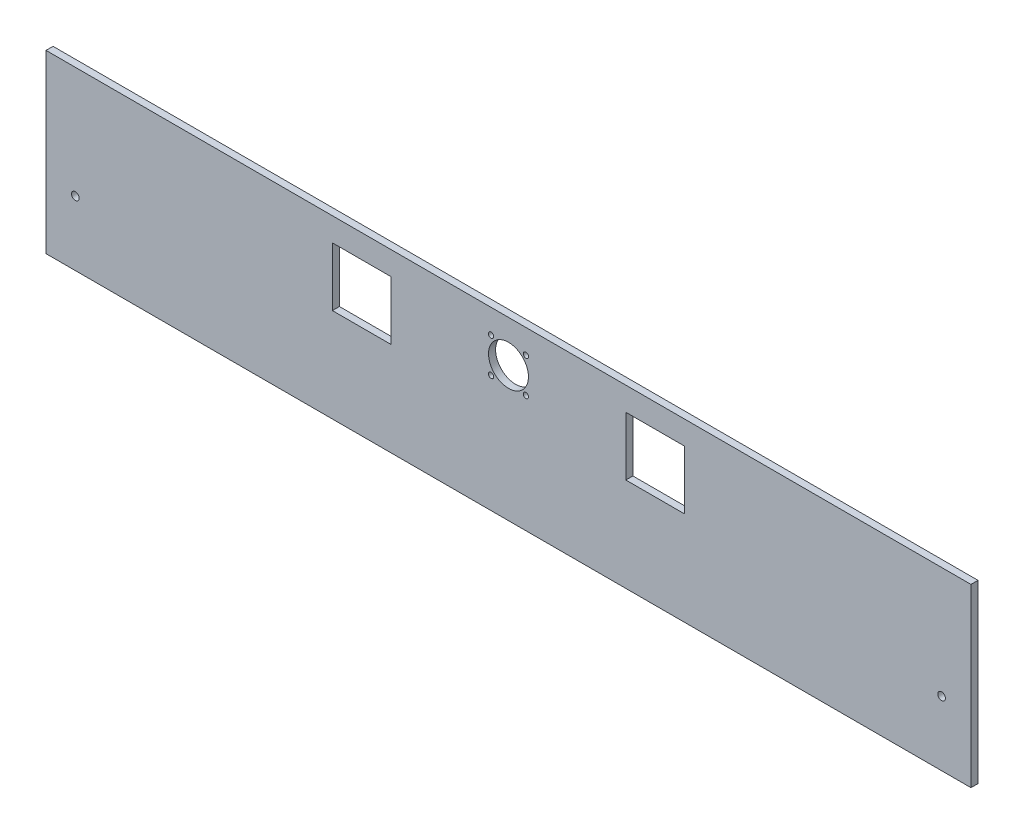
from build123d import *

# Parameters (mm, degrees)
SKETCH1_W          = 788
SKETCH1_H          = 150
BASE_FLANGE1_DEPTH = 6
SKETCH2_R          = 2.25
SKETCH2_R_2        = 17
SKETCH2_W          = 50
SKETCH2_H          = 50
CUT_EXTRUDE1_DEPTH = 402.119682888
SKETCH3_R          = 3.25
CUT_EXTRUDE2_DEPTH = 10


# Sheet-metal steps are written as plain solids
with BuildPart() as part:
    # Sketch1 → Base-Flange1 (new body)
    with BuildSketch(Plane.XY):
        Rectangle(SKETCH1_W, SKETCH1_H)
    extrude(amount=-BASE_FLANGE1_DEPTH)

    # Sketch2 → Cut-Extrude1 (cut, through all)
    with BuildSketch(Plane.XY):
        with Locations((14.849242405, 54.499242405)):
            Circle(SKETCH2_R)
        with Locations((-14.849242405, 54.499242405)):
            Circle(SKETCH2_R)
        with Locations((-14.849242405, 24.800757595)):
            Circle(SKETCH2_R)
        with Locations((14.849242405, 24.800757595)):
            Circle(SKETCH2_R)
        with Locations((0, 39.65)):
            Circle(SKETCH2_R_2)
        with Locations((-125, 30)):
            Rectangle(SKETCH2_W, SKETCH2_H)
        with Locations((125, 30)):
            Rectangle(SKETCH2_W, SKETCH2_H)
    extrude(amount=-CUT_EXTRUDE1_DEPTH, mode=Mode.SUBTRACT)

    # Sketch3 → Cut-Extrude2 (cut)
    with BuildSketch(Plane.XY):
        with Locations((369, -20)):
            Circle(SKETCH3_R)
        with Locations((-369, -20)):
            Circle(SKETCH3_R)
    extrude(amount=-CUT_EXTRUDE2_DEPTH, mode=Mode.SUBTRACT)


solid = part.part
